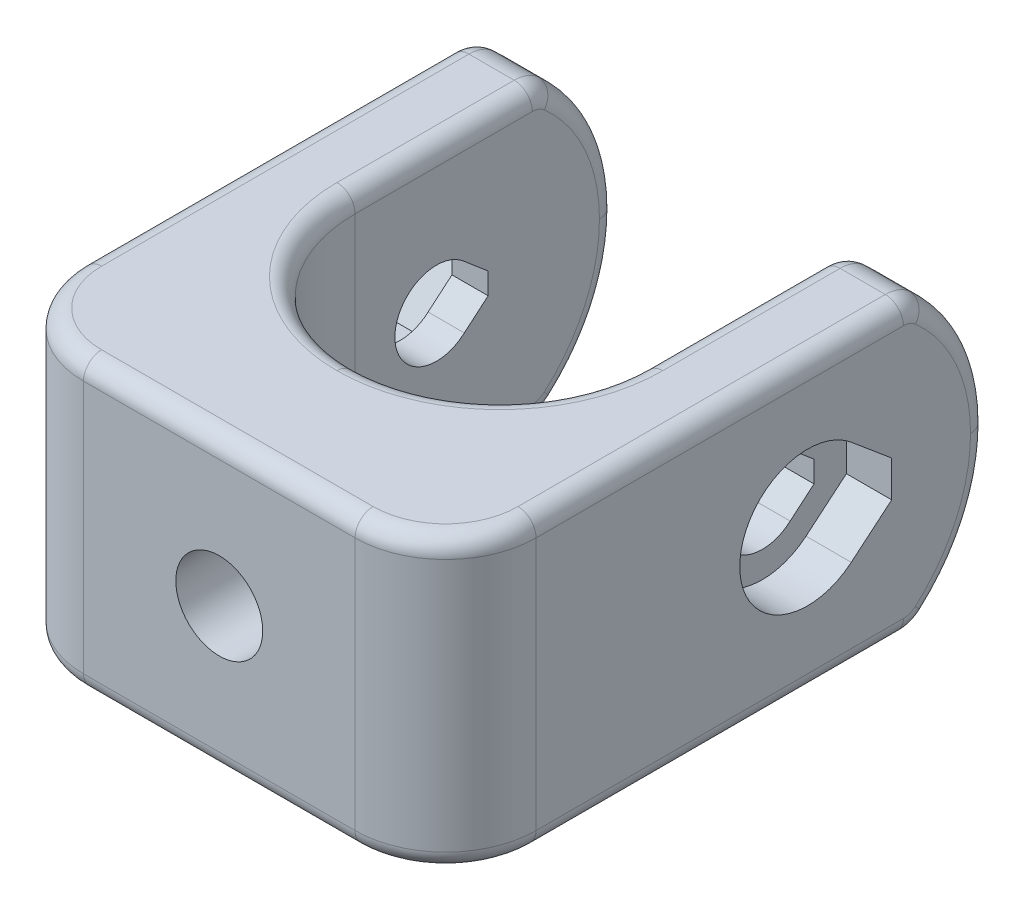
from build123d import *

# Parameters (mm, degrees)
CROQUIS1_W                   = 25
CROQUIS1_H                   = 20
SALIENTE_EXTRUIR1_DEPTH      = 30
CORTAR_EXTRUIR1_REACH        = 40.161
CROQUIS2_W                   = 16
CROQUIS2_H                   = 45
TALADRO_DE_MARGEN_PARA_M51_D = 4.6
CROQUIS8_R                   = 3.75
CORTAR_EXTRUIR4_DEPTH        = 2.5
CORTAR_EXTRUIR5_DEPTH        = 2.5
TALADRO_DE_MARGEN_PARA_M52_D = 4.8
CORTAR_EXTRUIR6_DEPTH        = 3
REDONDEO1_R                  = 10
REDONDEO2_R                  = 5
REDONDEO3_R                  = 8
CORTAR_EXTRUIR7_DEPTH        = 39.810436741
CORTAR_EXTRUIR8_DEPTH        = 2.5
CORTAR_EXTRUIR9_START        = -10
CORTAR_EXTRUIR9_DEPTH        = 2
CORTAR_EXTRUIR9_START_2      = 8
CORTAR_EXTRUIR9_2_DEPTH      = 2
REDONDEO4_R                  = 2
REDONDEO5_R                  = 1


# Read off the part's stored shape, not the designer's step: Cortar-Extruir9
# Some blends are built 0.0001 mm under size
with BuildPart() as part:
    # Croquis1 → Saliente-Extruir1 (new body)
    with BuildSketch(Plane.XY):
        Rectangle(CROQUIS1_W, CROQUIS1_H)
    extrude(amount=SALIENTE_EXTRUIR1_DEPTH)

    # Croquis2 → Cortar-Extruir1 (cut, up to next)
    with BuildSketch(Plane(origin=(0, 10, 0), x_dir=(1, 0, 0), z_dir=(0, 1, 0)), mode=Mode.PRIVATE) as cortar_extruir1_sk1:
        Rectangle(CROQUIS2_W, CROQUIS2_H)
    cortar_extruir1_tool1 = extrude(cortar_extruir1_sk1.sketch, amount=-CORTAR_EXTRUIR1_REACH, mode=Mode.PRIVATE) & part.part
    add(cortar_extruir1_tool1.solids().sort_by_distance((0, 10, 0))[0], mode=Mode.SUBTRACT)

    # Taladro de margen para M51 (through all)
    with Locations(Plane(origin=(12.5, 0, 0), x_dir=(0, 0, -1), z_dir=(1, 0, 0))):
        with Locations((-10, 0)):
            Hole(TALADRO_DE_MARGEN_PARA_M51_D / 2)

    # Croquis8 → Cortar-Extruir4 (cut)
    with BuildSketch(Plane(origin=(12.5, 0, 0), x_dir=(0, 0, -1), z_dir=(1, 0, 0))):
        with Locations((-10, 0)):
            Circle(CROQUIS8_R)
    extrude(amount=-CORTAR_EXTRUIR4_DEPTH, mode=Mode.SUBTRACT)

    # Croquis9 → Cortar-Extruir5 (cut)
    with BuildSketch(Plane.ZY.offset(12.5)):
        Polygon((5.785343035, 0), (7.892671517, -3.65), (12.107328483, -3.65), (14.214656965, 0), (12.107328483, 3.65), (7.892671517, 3.65), align=None)
    extrude(amount=-CORTAR_EXTRUIR5_DEPTH, mode=Mode.SUBTRACT)

    # Taladro de margen para M52 (through all)
    with Locations(Plane.XY.offset(30)):
        with Locations((0, 0)):
            Hole(TALADRO_DE_MARGEN_PARA_M52_D / 2)

    # Croquis13 → Cortar-Extruir6 (cut)
    with BuildSketch(Plane(origin=(0, 0, 22.5), x_dir=(-1, 0, 0), z_dir=(0, 0, -1))):
        Polygon((2.109650745, 3.648658256), (-2.105005367, 3.651340266), (-4.214656112, 0.00268201), (-2.109650745, -3.648658256), (2.105005367, -3.651340266), (4.214656112, -0.00268201), align=None)
    extrude(amount=-CORTAR_EXTRUIR6_DEPTH, mode=Mode.SUBTRACT)

    # Redondeo1
    redondeo1_edges = [part.edges().sort_by_distance(p)[0] for p in [
        (-10.25, -10, 0),
        (-10.25, 10, 0),
        (10.25, -10, 0),
        (10.25, 10, 0),
    ]]
    fillet(redondeo1_edges, radius=REDONDEO1_R - 0.0001)  # a hair under: the kernel refuses the full size

    # Redondeo2
    redondeo2_edges = [part.edges().sort_by_distance(p)[0] for p in [
        (-12.5, 0, 30),
        (12.5, 0, 30),
    ]]
    fillet(redondeo2_edges, radius=REDONDEO2_R)

    # Redondeo3
    # the kernel refuses this fillet: 8 mm, written as the material it adds along each edge
    with BuildSketch(Plane(origin=(-8, 10, 22.5), x_dir=(0, 0, -1), z_dir=(0, -1, 0))) as redondeo3_piece_1_section:
        with BuildLine():
            CenterArc((REDONDEO3_R, REDONDEO3_R), REDONDEO3_R, 180, 90)
            Line((0, REDONDEO3_R), (0, 0))
            Line((0, 0), (REDONDEO3_R, 0))
        make_face()
    redondeo3_piece_1 = extrude(amount=40, mode=Mode.PRIVATE)
    redondeo3_piece_1 = split(redondeo3_piece_1, bisect_by=Plane(origin=(-1.542701741, 4.632087449, 20.877990823), z_dir=(-0.8663434050364778, 0.49944880072916537, 0)), keep=Keep.TOP, mode=Mode.PRIVATE)
    add(redondeo3_piece_1)
    with BuildSketch(Plane(origin=(-8, 30, 22.5), x_dir=(0, 0, -1), z_dir=(0, -1, 0))) as redondeo3_piece_2_section:
        with BuildLine():
            CenterArc((REDONDEO3_R, REDONDEO3_R), REDONDEO3_R, 180, 90)
            Line((0, REDONDEO3_R), (0, 0))
            Line((0, 0), (REDONDEO3_R, 0))
        make_face()
    redondeo3_piece_2 = extrude(amount=60, mode=Mode.PRIVATE)
    redondeo3_piece_2 = split(redondeo3_piece_2, bisect_by=Plane(origin=(-1.583425809, 4.561447519, 22.44370091), z_dir=(0.8663434050364778, -0.49944880072916537, 0)), keep=Keep.TOP, mode=Mode.PRIVATE)
    redondeo3_piece_2 = split(redondeo3_piece_2, bisect_by=Plane(origin=(-1.267040589, 3.649194454, 22.44370091), z_dir=(-0.0006363531971100188, 0.9999997975272839, 0)), keep=Keep.TOP, mode=Mode.PRIVATE)
    add(redondeo3_piece_2)
    with BuildSketch(Plane(origin=(-8, 30, 22.5), x_dir=(0, 0, -1), z_dir=(0, -1, 0))) as redondeo3_piece_3_section:
        with BuildLine():
            CenterArc((REDONDEO3_R, REDONDEO3_R), REDONDEO3_R, 180, 90)
            Line((0, REDONDEO3_R), (0, 0))
            Line((0, 0), (REDONDEO3_R, 0))
        make_face()
    redondeo3_piece_3 = extrude(amount=40, mode=Mode.PRIVATE)
    redondeo3_piece_3 = split(redondeo3_piece_3, bisect_by=Plane(origin=(-1.265169081, -3.650805834, 22.443951569), z_dir=(0.0006363531971099136, -0.9999997975272839, 0)), keep=Keep.TOP, mode=Mode.PRIVATE)
    add(redondeo3_piece_3)
    with BuildSketch(Plane(origin=(-8, 30, 22.5), x_dir=(0, 0, -1), z_dir=(0, -1, 0))) as redondeo3_piece_4_section:
        with BuildLine():
            CenterArc((REDONDEO3_R, REDONDEO3_R), REDONDEO3_R, 180, 90)
            Line((0, REDONDEO3_R), (0, 0))
            Line((0, 0), (REDONDEO3_R, 0))
        make_face()
    redondeo3_piece_4 = extrude(amount=60, mode=Mode.PRIVATE)
    redondeo3_piece_4 = split(redondeo3_piece_4, bisect_by=Plane(origin=(-3.239385645, -1.689420276, 21.740409099), z_dir=(-0.865707051839368, -0.5005509967981187, 0)), keep=Keep.TOP, mode=Mode.PRIVATE)
    redondeo3_piece_4 = split(redondeo3_piece_4, bisect_by=Plane(origin=(-4.581718949, -3.652916331, 21.740409099), z_dir=(-0.0006363531971099136, 0.9999997975272839, 0)), keep=Keep.TOP, mode=Mode.PRIVATE)
    add(redondeo3_piece_4)
    with BuildSketch(Plane(origin=(8, 10, 22.5), x_dir=(-1, 0, 0), z_dir=(0, -1, 0))) as redondeo3_piece_5_section:
        with BuildLine():
            CenterArc((REDONDEO3_R, REDONDEO3_R), REDONDEO3_R, 180, 90)
            Line((0, REDONDEO3_R), (0, 0))
            Line((0, 0), (REDONDEO3_R, 0))
        make_face()
    redondeo3_piece_5 = extrude(amount=40, mode=Mode.PRIVATE)
    redondeo3_piece_5 = split(redondeo3_piece_5, bisect_by=Plane(origin=(1.539300271, 4.629731866, 20.879744511), z_dir=(0.8657070518393678, 0.5005509967981188, 0)), keep=Keep.TOP, mode=Mode.PRIVATE)
    add(redondeo3_piece_5)
    with BuildSketch(Plane(origin=(8, 30, 22.5), x_dir=(-1, 0, 0), z_dir=(0, -1, 0))) as redondeo3_piece_6_section:
        with BuildLine():
            CenterArc((REDONDEO3_R, REDONDEO3_R), REDONDEO3_R, 180, 90)
            Line((0, REDONDEO3_R), (0, 0))
            Line((0, 0), (REDONDEO3_R, 0))
        make_face()
    redondeo3_piece_6 = extrude(amount=60, mode=Mode.PRIVATE)
    redondeo3_piece_6 = split(redondeo3_piece_6, bisect_by=Plane(origin=(1.579702806, 4.559855351, 22.443951569), z_dir=(-0.8657070518393678, -0.5005509967981188, 0)), keep=Keep.TOP, mode=Mode.PRIVATE)
    redondeo3_piece_6 = split(redondeo3_piece_6, bisect_by=Plane(origin=(1.265169081, 3.650805834, 22.443951569), z_dir=(-0.0006363531971100188, 0.9999997975272839, 0)), keep=Keep.TOP, mode=Mode.PRIVATE)
    add(redondeo3_piece_6)
    with BuildSketch(Plane(origin=(8, 30, 22.5), x_dir=(-1, 0, 0), z_dir=(0, -1, 0))) as redondeo3_piece_7_section:
        with BuildLine():
            CenterArc((REDONDEO3_R, REDONDEO3_R), REDONDEO3_R, 180, 90)
            Line((0, REDONDEO3_R), (0, 0))
            Line((0, 0), (REDONDEO3_R, 0))
        make_face()
    redondeo3_piece_7 = extrude(amount=40, mode=Mode.PRIVATE)
    redondeo3_piece_7 = split(redondeo3_piece_7, bisect_by=Plane(origin=(3.24131014, -1.685682967, 21.739264783), z_dir=(0.8663434050364778, -0.49944880072916537, 0)), keep=Keep.TOP, mode=Mode.PRIVATE)
    add(redondeo3_piece_7)
    with BuildSketch(Plane(origin=(8, 30, 22.5), x_dir=(-1, 0, 0), z_dir=(0, -1, 0))) as redondeo3_piece_8_section:
        with BuildLine():
            CenterArc((REDONDEO3_R, REDONDEO3_R), REDONDEO3_R, 180, 90)
            Line((0, REDONDEO3_R), (0, 0))
            Line((0, 0), (REDONDEO3_R, 0))
        make_face()
    redondeo3_piece_8 = extrude(amount=60, mode=Mode.PRIVATE)
    redondeo3_piece_8 = split(redondeo3_piece_8, bisect_by=Plane(origin=(1.267040588, -3.649194454, 22.44370091), z_dir=(0.0006363531971099136, -0.9999997975272839, 0)), keep=Keep.TOP, mode=Mode.PRIVATE)
    redondeo3_piece_8 = split(redondeo3_piece_8, bisect_by=Plane(origin=(1.583425809, -4.561447518, 22.44370091), z_dir=(-0.8663434050364778, 0.49944880072916537, 0)), keep=Keep.TOP, mode=Mode.PRIVATE)
    add(redondeo3_piece_8)

    # Croquis14 → Cortar-Extruir7 (cut, through all)
    with BuildSketch(Plane.ZY.offset(10)):
        Polygon((8.558178994, 1.791968801), (7.1476261, 0.592860429), (7.1476261, -0.592860429), (8.558178994, -1.791968801), align=None)
    extrude(amount=-CORTAR_EXTRUIR7_DEPTH, mode=Mode.SUBTRACT)

    # Croquis15 → Cortar-Extruir8 (cut)
    with BuildSketch(Plane(origin=(12.5, 0, 0), x_dir=(0, 0, -1), z_dir=(1, 0, 0))):
        with BuildLine():
            Line((-7.589546464, 2.872666662), (-5.357789242, 1))
            Line((-5.357789242, 1), (-5.357789242, -1))
            Line((-5.357789242, -1), (-7.589546464, -2.872666662))
            ThreePointArc((-7.589546464, -2.872666662), (-6.25, 0), (-7.589546464, 2.872666662))
        make_face()
    extrude(amount=-CORTAR_EXTRUIR8_DEPTH, mode=Mode.SUBTRACT)

    # Cortar-Extruir9 outline → Cortar-Extruir9 (cut)
    with BuildSketch(Plane(origin=(0, 0, 0), x_dir=(1, 0, 0), z_dir=(0, 1, 0)).offset(CORTAR_EXTRUIR9_START)):
        with BuildLine():
            Line((12.5, -25), (12.5, -3))
            Line((12.5, -3), (8, -3))
            Line((8, -3), (8, -14.5))
            ThreePointArc((8, -14.5), (5.656854249, -20.156854249), (0, -22.5))
            ThreePointArc((0, -22.5), (-5.656854249, -20.156854249), (-8, -14.5))
            Line((-8, -14.5), (-8, -3))
            Line((-8, -3), (-12.5, -3))
            Line((-12.5, -3), (-12.5, -25))
            ThreePointArc((-12.5, -25), (-11.035533906, -28.535533906), (-7.5, -30))
            Line((-7.5, -30), (7.5, -30))
            ThreePointArc((7.5, -30), (11.035533906, -28.535533906), (12.5, -25))
        make_face()
    extrude(amount=CORTAR_EXTRUIR9_DEPTH, mode=Mode.SUBTRACT)

    # Cortar-Extruir9 2 outline → Cortar-Extruir9 2 (cut)
    with BuildSketch(Plane(origin=(0, 0, 0), x_dir=(1, 0, 0), z_dir=(0, 1, 0)).offset(CORTAR_EXTRUIR9_START_2)):
        with BuildLine():
            Line((12.5, -25), (12.5, -3))
            Line((12.5, -3), (8, -3))
            Line((8, -3), (8, -14.5))
            ThreePointArc((8, -14.5), (5.656854249, -20.156854249), (0, -22.5))
            ThreePointArc((0, -22.5), (-5.656854249, -20.156854249), (-8, -14.5))
            Line((-8, -14.5), (-8, -3))
            Line((-8, -3), (-12.5, -3))
            Line((-12.5, -3), (-12.5, -25))
            ThreePointArc((-12.5, -25), (-11.035533906, -28.535533906), (-7.5, -30))
            Line((-7.5, -30), (7.5, -30))
            ThreePointArc((7.5, -30), (11.035533906, -28.535533906), (12.5, -25))
        make_face()
    extrude(amount=CORTAR_EXTRUIR9_2_DEPTH, mode=Mode.SUBTRACT)

    # Redondeo4
    redondeo4_edges = [part.edges().sort_by_distance(p)[0] for p in [
        (-10.25, 8, 3.999933333),
        (10.25, 8, 3.999933333),
        (10.25, -8, 3.999933333),
        (-10.25, -8, 3.999933333),
    ]]
    fillet(redondeo4_edges, radius=REDONDEO4_R)

    # Redondeo5
    redondeo5_edges = [part.edges().sort_by_distance(p)[0] for p in [
        (-5.656854249, 8, 20.156854249),
        (12.5, 8, 14.854217587),
        (11.035533906, 8, 28.535533906),
        (-11.035533906, 8, 28.535533906),
        (-12.5, 8, 14.854217587),
        (5.656854249, 8, 20.156854249),
        (8, 8, 9.604217587),
        (0, 8, 30),
        (-5.656854249, -8, 20.156854249),
        (11.035533906, -8, 28.535533906),
        (-11.035533906, -8, 28.535533906),
        (5.656854249, -8, 20.156854249),
        (-8, -8, 9.604217587),
        (0, -8, 30),
        (-12.5, -8, 14.854217587),
        (8, -8, 9.604217587),
        (12.5, -8, 14.854217587),
        (12.5, -4.114415603, 0.885603147),
        (12.5, 7.870827023, 4.001323974),
        (12.5, -7.870827023, 4.001323974),
        (8, 4.114415603, 0.885603147),
        (8, 7.870827023, 4.001323974),
        (8, -7.870827023, 4.001323974),
        (-8, -4.114415603, 0.885603147),
        (-8, 8, 9.604217587),
        (-8, 7.870827023, 4.001323974),
        (-8, -7.870827023, 4.001323974),
        (-12.5, 4.114415603, 0.885603147),
        (-12.5, 7.870827023, 4.001323974),
        (-12.5, -7.870827023, 4.001323974),
        (-8, 4.114415603, 0.885603147),
        (-12.5, -4.114415603, 0.885603147),
        (12.5, 4.114415603, 0.885603147),
        (8, -4.114415603, 0.885603147),
    ]]
    fillet(redondeo5_edges, radius=REDONDEO5_R)


solid = part.part
